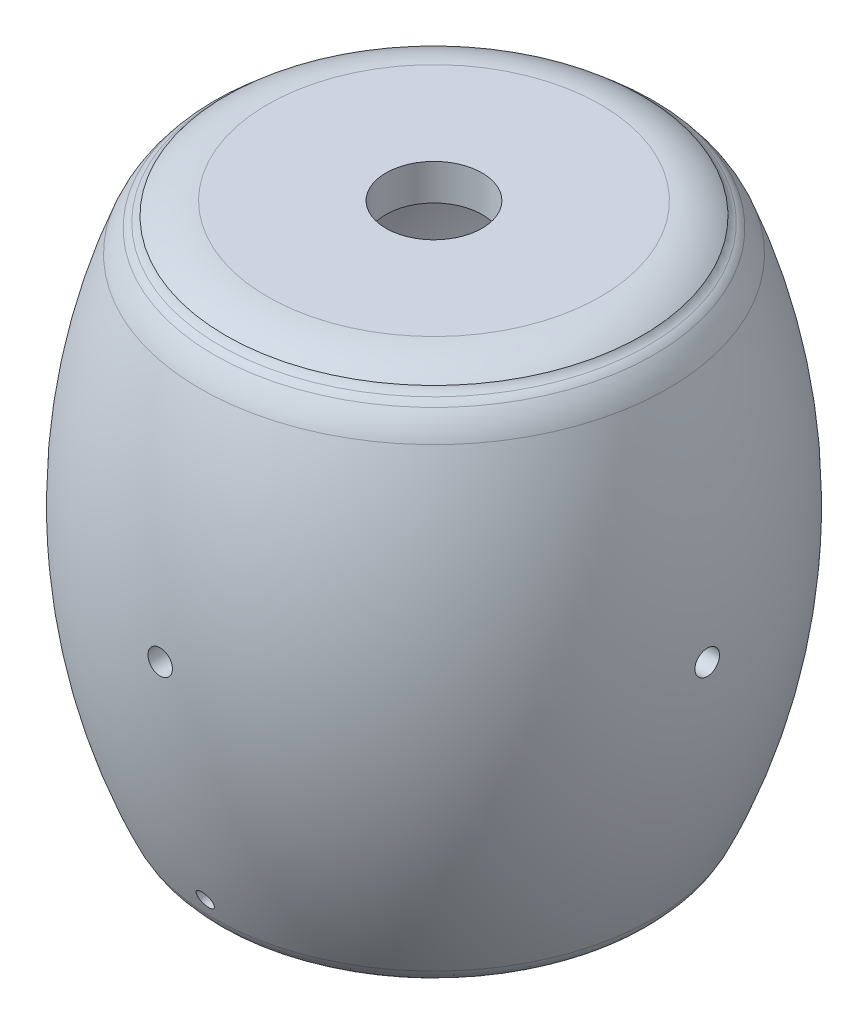
from build123d import *

# Parameters (mm, degrees)
SKETCH3_R               = 81
SKETCH3_R_2             = 77.501248024
CUT_EXTRUDE1_DEPTH      = 20
SKETCH5_R               = 20
CUT_EXTRUDE3_DEPTH      = 20
CUT_EXTRUDE4_DEPTH      = 30
CUT_EXTRUDE4_DEPTH_BACK = 410
SKETCH6_R               = 5.1
CUT_EXTRUDE5_DEPTH      = 322.036625044
CUT_EXTRUDE5_DEPTH_BACK = 322.036625044
SKETCH7_R               = 5.1
CUT_EXTRUDE6_DEPTH      = 364.804332844
CUT_EXTRUDE6_DEPTH_BACK = 12
SKETCH8_R               = 3.55


with BuildPart() as part:
    # Sketch2 → Revolve1 (revolve)
    with BuildSketch(Plane.XY):
        with BuildLine():
            ThreePointArc((-3.446088837, 214.546614293), (-11.648846932, 218.604181764), (-20.693225606, 220))
            Line((-20.693225606, 220), (-90, 220))
            Line((-90, 220), (-90, 205))
            Line((-90, 205), (-20.693225606, 205))
            ThreePointArc((-20.693225606, 205), (-12.209917689, 202.370670426), (-6.700664758, 195.404464906))
            ThreePointArc((-6.700664758, 195.404464906), (8.978164508, 103.730969885), (-12.13455183, 13.154435476))
            Line((-12.13455183, 13.154435476), (-19.281789599, 12.479876035))
            Line((-19.281789599, 12.479876035), (-19.281789599, 0))
            Line((-19.281789599, 0), (-4.926165928, 0))
            ThreePointArc((-4.926165928, 0), (-1.147491573, 2.942456876), (1.511165162, 6.92591978))
            ThreePointArc((1.511165162, 6.92591978), (23.971501692, 103.283935109), (7.29189609, 200.808929812))
            ThreePointArc((7.29189609, 200.808929812), (4.841723152, 205.746948655), (1.529394516, 210.153291416))
            ThreePointArc((1.529394516, 210.153291416), (0.336924673, 211.269613546), (-1.021373152, 212.176909774))
            ThreePointArc((-1.021373152, 212.176909774), (-2.392726704, 213.199075341), (-3.446088837, 214.546614293))
        make_face()
    revolve(axis=Axis((-90, -83.445440151, 0), (0, 1, 0)))

    # Sketch3 → Cut-Extrude1 (cut)
    with BuildSketch(Plane.XZ):
        with Locations((-90, 0)):
            Circle(SKETCH3_R)
        with Locations((-90, 0)):
            Circle(SKETCH3_R_2, mode=Mode.SUBTRACT)
    extrude(amount=-CUT_EXTRUDE1_DEPTH, mode=Mode.SUBTRACT)


with BuildPart() as cut_extrude1_piece_1:
    # of the separate pieces the step leaves, piece 1, a body of its own (cut_extrude1_pieces)
    add(part.part.solids().sort_by_distance((1.511165162, 6.92591978, 0))[0])

    # Sketch2<3> → Revolve2 (revolve)
    with BuildSketch(Plane.XY):
        with BuildLine():
            ThreePointArc((-3.446088837, 214.546614293), (-11.648846932, 218.604181764), (-20.693225606, 220))
            Line((-20.693225606, 220), (-90, 220))
            Line((-90, 220), (-90, 205))
            Line((-90, 205), (-20.693225606, 205))
            ThreePointArc((-20.693225606, 205), (-12.209917689, 202.370670426), (-6.700664758, 195.404464906))
            ThreePointArc((-6.700664758, 195.404464906), (8.978164508, 103.730969885), (-12.13455183, 13.154435476))
            Line((-12.13455183, 13.154435476), (-19.281789599, 12.479876035))
            Line((-19.281789599, 12.479876035), (-19.281789599, 0))
            Line((-19.281789599, 0), (-4.926165928, 0))
            ThreePointArc((-4.926165928, 0), (-1.147491573, 2.942456876), (1.511165162, 6.92591978))
            ThreePointArc((1.511165162, 6.92591978), (23.971501692, 103.283935109), (7.29189609, 200.808929812))
            ThreePointArc((7.29189609, 200.808929812), (4.841723152, 205.746948655), (1.529394516, 210.153291416))
            ThreePointArc((1.529394516, 210.153291416), (0.336924673, 211.269613546), (-1.021373152, 212.176909774))
            ThreePointArc((-1.021373152, 212.176909774), (-2.392726704, 213.199075341), (-3.446088837, 214.546614293))
        make_face()
    revolve(axis=Axis((-90, -83.445440151, 0), (0, 1, 0)))

    # Sketch5 → Cut-Extrude3 (cut)
    with BuildSketch(Plane(origin=(0, 220, 0), x_dir=(1, 0, 0), z_dir=(0, 1, 0))):
        with Locations((-90, 0)):
            Circle(SKETCH5_R)
    extrude(amount=-CUT_EXTRUDE3_DEPTH, mode=Mode.SUBTRACT)

    # Sketch6 → Cut-Extrude4 (cut, two sides: drawn at the far end of the back side and taken through both)
    with BuildSketch(Plane.XY.offset(91.7).offset(-CUT_EXTRUDE4_DEPTH_BACK)):
        with Locations((-90, 110.734514709)):
            Circle(SKETCH6_R)
    extrude(amount=CUT_EXTRUDE4_DEPTH + CUT_EXTRUDE4_DEPTH_BACK, mode=Mode.SUBTRACT)

    # Sketch7 → Cut-Extrude5 (cut, two sides: drawn at the far end of the back side and taken through both)
    with BuildSketch(Plane(origin=(0, 0, 0), x_dir=(0, 0, -1), z_dir=(1, 0, 0)).offset(-CUT_EXTRUDE5_DEPTH_BACK)):
        with Locations((-0.244758935, 110.734514709)):
            Circle(SKETCH7_R)
    extrude(amount=CUT_EXTRUDE5_DEPTH + CUT_EXTRUDE5_DEPTH_BACK, mode=Mode.SUBTRACT)

    # Sketch8 → Cut-Extrude6 (cut, two sides: drawn at the far end of the back side and taken through both)
    with BuildSketch(Plane.XY.offset(91.7).offset(-CUT_EXTRUDE6_DEPTH_BACK)):
        with Locations((-90, 15.629680066)):
            Circle(SKETCH8_R)
    extrude(amount=CUT_EXTRUDE6_DEPTH + CUT_EXTRUDE6_DEPTH_BACK, mode=Mode.SUBTRACT)


with BuildPart() as cut_extrude1_piece_2:
    # of the separate pieces the step leaves, piece 2, a body of its own (cut_extrude1_pieces)
    add(part.part.solids().sort_by_distance((-12.498751976, 0, 0))[0])


solid = Compound([cut_extrude1_piece_1.part, cut_extrude1_piece_2.part])
